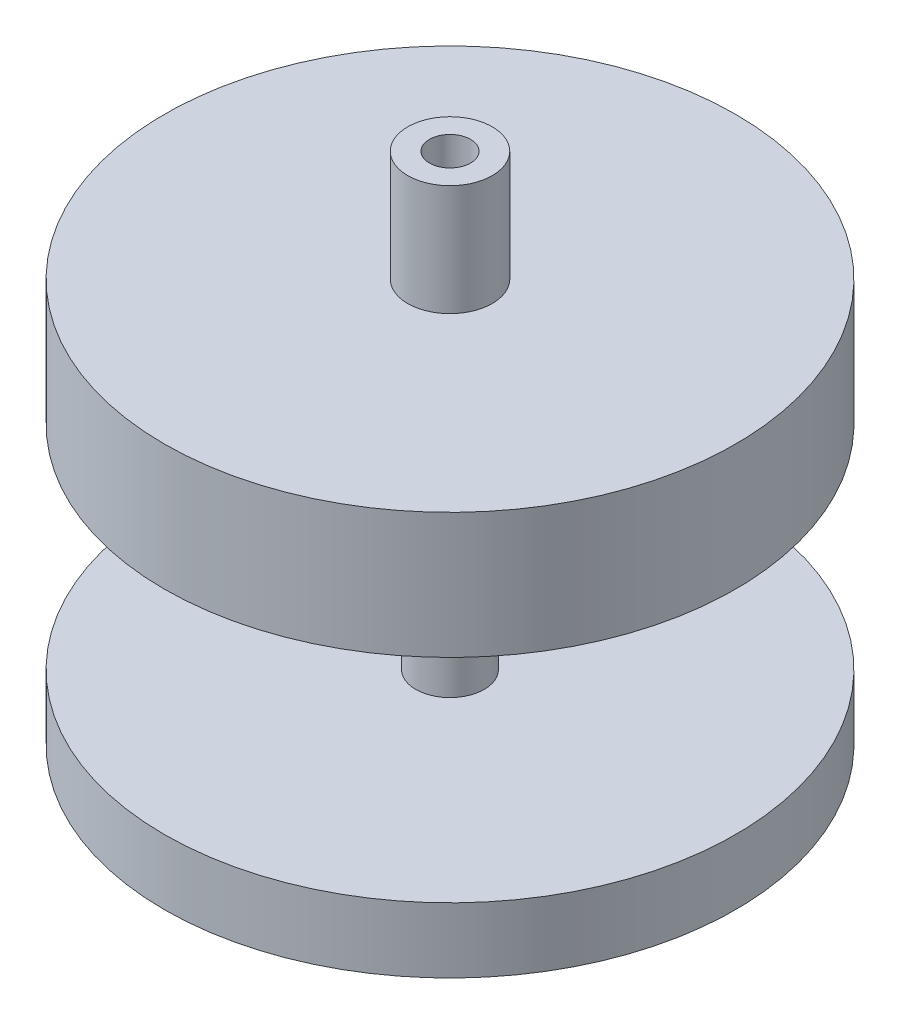
from build123d import *

# Parameters (mm, degrees)
SKETCH1_R           = 25
BOSS_EXTRUDE1_DEPTH = 5.7
SKETCH2_R           = 3
BOSS_EXTRUDE2_DEPTH = 18.6
SKETCH3_R           = 25
BOSS_EXTRUDE3_DEPTH = 11
SKETCH4_R           = 1.5
CUT_EXTRUDE1_DEPTH  = 50.9608847
SKETCH5_R           = 3.7
BOSS_EXTRUDE4_DEPTH = 9.7
SKETCH6_R           = 1.8
CUT_EXTRUDE2_DEPTH  = 58.227615711


with BuildPart() as part:
    # Sketch1 → Boss-Extrude1 (new body)
    with BuildSketch(Plane(origin=(0, 0, 0), x_dir=(1, 0, 0), z_dir=(0, 1, 0))):
        Circle(SKETCH1_R)
    extrude(amount=BOSS_EXTRUDE1_DEPTH)

    # Sketch2 → Boss-Extrude2 (add)
    with BuildSketch(Plane(origin=(0, 5.7, 0), x_dir=(1, 0, 0), z_dir=(0, 1, 0))):
        Circle(SKETCH2_R)
    extrude(amount=BOSS_EXTRUDE2_DEPTH)

    # Sketch3 → Boss-Extrude3 (add)
    with BuildSketch(Plane(origin=(0, 24.3, 0), x_dir=(1, 0, 0), z_dir=(0, 1, 0))):
        Circle(SKETCH3_R)
    extrude(amount=BOSS_EXTRUDE3_DEPTH)

    # Sketch4 → Cut-Extrude1 (cut, through all)
    with BuildSketch(Plane(origin=(0, 35.3, 0), x_dir=(1, 0, 0), z_dir=(0, 1, 0))):
        Circle(SKETCH4_R)
    extrude(amount=-CUT_EXTRUDE1_DEPTH, mode=Mode.SUBTRACT)

    # Sketch5 → Boss-Extrude4 (add)
    with BuildSketch(Plane(origin=(0, 35.3, 0), x_dir=(1, 0, 0), z_dir=(0, 1, 0))):
        Circle(SKETCH5_R)
    extrude(amount=BOSS_EXTRUDE4_DEPTH)

    # Sketch6 → Cut-Extrude2 (cut, through all)
    with BuildSketch(Plane(origin=(0, 45, 0), x_dir=(1, 0, 0), z_dir=(0, 1, 0))):
        Circle(SKETCH6_R)
    extrude(amount=-CUT_EXTRUDE2_DEPTH, mode=Mode.SUBTRACT)


solid = part.part
